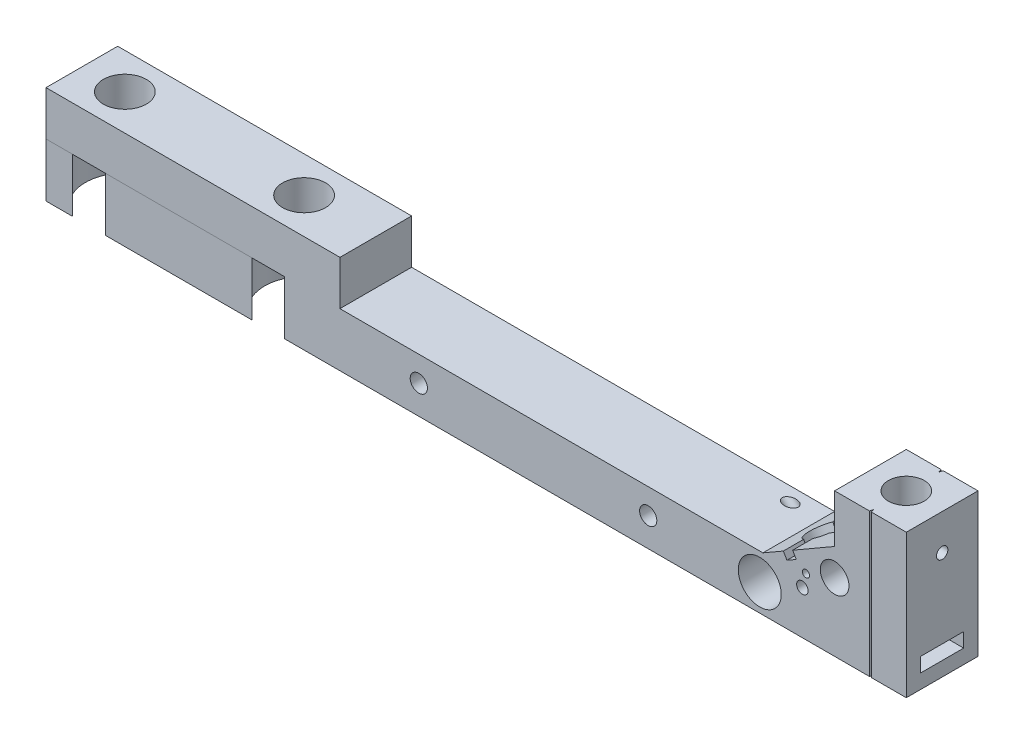
from build123d import *

# Parameters (mm, degrees)
SKETCH1_W                                    = 20
SKETCH1_H                                    = 10
BOSS_EXTRUDE1_DEPTH                          = 20
SKETCH2_R                                    = 2.5
CUT_EXTRUDE1_DEPTH                           = 26.836409614
CUT_EXTRUDE2_DEPTH                           = 27.191969955
CUT_EXTRUDE5_DEPTH                           = 20.59843291
M2X0_4_TAPPED_HOLE1_D                        = 1.6
M2X0_4_TAPPED_HOLE1_DEPTH                    = 6
M2X0_4_TAPPED_HOLE1_TIP                      = 0.480688495
M2X0_4_TAPPED_HOLE2_D                        = 1.6
M2X0_4_TAPPED_HOLE2_DEPTH                    = 6
M2X0_4_TAPPED_HOLE2_TIP                      = 0.480688495
SKETCH14_W                                   = 10
SKETCH14_H                                   = 7.505553499
BOSS_EXTRUDE3_DEPTH                          = 100
CUT_EXTRUDE7_REACH                           = 116.68
SKETCH15_R                                   = 3
SKETCH18_R                                   = 0.5
CUT_EXTRUDE9_DEPTH                           = 3
SKETCH23_R                                   = 5.5
CUT_EXTRUDE10_DEPTH                          = 8
SKETCH24_W                                   = 41
SKETCH24_H                                   = 10
SKETCH24_R                                   = 3
BOSS_EXTRUDE4_DEPTH                          = 6.2
SKETCH27_R                                   = 2
CUT_EXTRUDE11_DEPTH                          = 116.817947978
M2X0_4_TAPPED_HOLE4_OUTLINE_W                = 0.8
M2X0_4_TAPPED_HOLE4_OUTLINE_H                = 1.439804136
SKETCH32_R                                   = 3
CUT_EXTRUDE12_DEPTH                          = 116.817947978
CBORE_FOR_M2_HEX_SOCKET_HEAD_CAP2_AT_2_COUNT = 2
CBORE_FOR_M2_HEX_SOCKET_HEAD_CAP2_AT_2_PITCH = 32
M2X0_4_START                                 = -18.717024707
M2X0_4_TAPPED_HOLE7_OUTLINE_R                = 0.8
M2X0_4_TAPPED_HOLE7_DEPTH                    = 3.215861518
SKETCH48_W                                   = 6
SKETCH48_H                                   = 2
CUT_EXTRUDE14_DEPTH                          = 8


# Read off the part's stored shape, not the designer's step: M2x0.4 Tapped Hole4, M2x0.4 Tapped Hole7
with BuildPart() as part:
    # Sketch1 → Boss-Extrude1 (new body)
    with BuildSketch(Plane(origin=(0, 0, 0), x_dir=(1, 0, 0), z_dir=(0, 1, 0))):
        with Locations((-3.638888889, 4.027777778)):
            Rectangle(SKETCH1_W, SKETCH1_H)
    extrude(amount=BOSS_EXTRUDE1_DEPTH)

    # Sketch2 → Cut-Extrude1 (cut, through all)
    with BuildSketch(Plane(origin=(0, 20, 0), x_dir=(1, 0, 0), z_dir=(0, 1, 0))):
        with Locations(Location((1.361111111, 4.027777778, 0), (0, 0, 270))):
            Circle(SKETCH2_R)
        Polygon((1.495085707, -0.972222222), (1.361111111, -0.472222222), (1.227136515, -0.972222222), align=None)
        Polygon((1.361111111, 8.527777778), (1.227136515, 9.027777778), (1.495085707, 9.027777778), align=None)
    extrude(amount=-CUT_EXTRUDE1_DEPTH, mode=Mode.SUBTRACT)

    # Sketch3 → Cut-Extrude2 (cut, through all)
    with BuildSketch(Plane.XY.offset(0.972222222)):
        Polygon((-13.638888889, 20), (-3.638888889, 20), (-3.638888889, 13.279056191), (-9.489369836, 9.901279442), (-8.989369836, 9.035254038), (-10.288407942, 8.285254038), (-10.788407942, 9.151279442), (-13.638888889, 7.505553499), align=None)
    extrude(amount=-CUT_EXTRUDE2_DEPTH, mode=Mode.SUBTRACT)

    # Sketch5 → Cut-Extrude5 (cut, through all)
    with BuildSketch(Plane(origin=(-6.659722222, 11.534977253, 0), x_dir=(0.8660254037844415, 0.49999999999999534, 0), z_dir=(-0.49999999999999534, 0.8660254037844415, 0))):
        with BuildLine():
            ThreePointArc((-4.993480159, 6.110386473), (-5.64374122, 2.401432181), (-1.934786927, 3.051693242))
            ThreePointArc((-1.934786927, 3.051693242), (-0.717395623, 4.027777778), (-1.934786927, 5.003862313))
            ThreePointArc((-1.934786927, 5.003862313), (-2.391050026, 5.654123375), (-3.041311087, 6.110386473))
            ThreePointArc((-3.041311087, 6.110386473), (-4.017395623, 7.327777778), (-4.993480159, 6.110386473))
        make_face()
    extrude(amount=-CUT_EXTRUDE5_DEPTH, mode=Mode.SUBTRACT)

    # M2x0.4 Tapped Hole1
    with Locations(Plane(origin=(6.361111111, 0, 0), x_dir=(0, 0, -1), z_dir=(1, 0, 0))):
        with Locations((4.027777778, 15)):
            Hole(M2X0_4_TAPPED_HOLE1_D / 2, depth=M2X0_4_TAPPED_HOLE1_DEPTH)
            with Locations((0, 0, -(M2X0_4_TAPPED_HOLE1_DEPTH + M2X0_4_TAPPED_HOLE1_TIP / 2))):  # 118° drill point
                Cone(0, M2X0_4_TAPPED_HOLE1_D / 2, M2X0_4_TAPPED_HOLE1_TIP, mode=Mode.SUBTRACT)

    # M2x0.4 Tapped Hole2
    with Locations(Plane.XY.offset(0.972222222)):
        with Locations((-8.138888889, 6.062177826)):
            Hole(M2X0_4_TAPPED_HOLE2_D / 2, depth=M2X0_4_TAPPED_HOLE2_DEPTH)
            with Locations((0, 0, -(M2X0_4_TAPPED_HOLE2_DEPTH + M2X0_4_TAPPED_HOLE2_TIP / 2))):  # 118° drill point
                Cone(0, M2X0_4_TAPPED_HOLE2_D / 2, M2X0_4_TAPPED_HOLE2_TIP, mode=Mode.SUBTRACT)

    # Sketch14 → Boss-Extrude3 (add)
    with BuildSketch(Plane.ZY.offset(13.638888889)):
        with Locations((-4.027777778, 3.75277675)):
            Rectangle(SKETCH14_W, SKETCH14_H)
    extrude(amount=BOSS_EXTRUDE3_DEPTH)

    # Sketch15 → Cut-Extrude7 (cut, up to next)
    with BuildSketch(Plane(origin=(0, 7.505553499, 0), x_dir=(1, 0, 0), z_dir=(0, 1, 0)), mode=Mode.PRIVATE) as cut_extrude7_sk1:
        with Locations(Location((-107.638888889, 4.027777778, 0), (0, 0, 270))):
            Circle(SKETCH15_R)
    cut_extrude7_tool1 = extrude(cut_extrude7_sk1.sketch, amount=-CUT_EXTRUDE7_REACH, mode=Mode.PRIVATE) & part.part
    # Sketch15 → Cut-Extrude7 (cut, up to next)
    with BuildSketch(Plane(origin=(0, 7.505553499, 0), x_dir=(1, 0, 0), z_dir=(0, 1, 0)), mode=Mode.PRIVATE) as cut_extrude7_sk2:
        with Locations(Location((-82.638888889, 4.027777778, 0), (0, 0, 270))):
            Circle(SKETCH15_R)
    cut_extrude7_tool2 = extrude(cut_extrude7_sk2.sketch, amount=-CUT_EXTRUDE7_REACH, mode=Mode.PRIVATE) & part.part
    add(cut_extrude7_tool1.solids().sort_by_distance((-107.638889, 7.505553, -4.027778))[0], mode=Mode.SUBTRACT)
    add(cut_extrude7_tool2.solids().sort_by_distance((-82.638889, 7.505553, -4.027778))[0], mode=Mode.SUBTRACT)

    # Sketch18 → Cut-Extrude9 (cut)
    with BuildSketch(Plane.XY.offset(0.972222222)):
        with Locations((-7.638888889, 8)):
            Circle(SKETCH18_R)
    extrude(amount=-CUT_EXTRUDE9_DEPTH, mode=Mode.SUBTRACT)

    # Sketch23 → Cut-Extrude10 (cut)
    with BuildSketch(Plane.XZ):
        with Locations((-107.638888889, -4.027777778)):
            Circle(SKETCH23_R)
        with Locations((-82.638888889, -4.027777778)):
            Circle(SKETCH23_R)
    extrude(amount=-CUT_EXTRUDE10_DEPTH, mode=Mode.SUBTRACT)


with BuildPart() as cut_extrude10_piece_1:
    # of the separate pieces the step leaves, piece 1, a body of its own (cut_extrude10_pieces)
    add(part.part.solids().sort_by_distance((1.227136515, 20, -9.027777778))[0])

    # Sketch24 → Boss-Extrude4 (add)
    with BuildSketch(Plane(origin=(0, 7.505553499, 0), x_dir=(1, 0, 0), z_dir=(0, 1, 0))):
        with Locations((-93.138888889, 4.027777778)):
            Rectangle(SKETCH24_W, SKETCH24_H)
        with Locations(Location((-107.638888889, 4.027777778, 0), (0, 0, 90))):
            Circle(SKETCH24_R, mode=Mode.SUBTRACT)
        with Locations(Location((-82.638888889, 4.027777778, 0), (0, 0, 90))):
            Circle(SKETCH24_R, mode=Mode.SUBTRACT)
    extrude(amount=BOSS_EXTRUDE4_DEPTH)

    # Sketch27 → Cut-Extrude11 (cut, through all)
    with BuildSketch(Plane(origin=(0, 0, -9.027777778), x_dir=(-1, 0, 0), z_dir=(0, 0, -1))):
        with Locations((3.638888889, 9.5)):
            Circle(SKETCH27_R)
    extrude(amount=-CUT_EXTRUDE11_DEPTH, mode=Mode.SUBTRACT)

    # M2x0.4 Tapped Hole4 outline → M2x0.4 Tapped Hole4 (revolve, cut)
    with BuildSketch(Plane(origin=(1.384454001, 0.79931489, -4.027777778), x_dir=(0.8660254037844406, 0.4999999999999967, 0), z_dir=(0, 0, -1))):
        with Locations((0.4, -12.599542376)):
            Rectangle(M2X0_4_TAPPED_HOLE4_OUTLINE_W, M2X0_4_TAPPED_HOLE4_OUTLINE_H)
    revolve(axis=Axis((1.384454001, 0.79931489, -4.027777778), (0.4999999999999967, -0.8660254037844406, 0)), mode=Mode.SUBTRACT)

    # Sketch32 → Cut-Extrude12 (cut, through all)
    with BuildSketch(Plane(origin=(0, 0, -9.027777778), x_dir=(-1, 0, 0), z_dir=(0, 0, -1))):
        with Locations((14.080168947, 3.75277675)):
            Circle(SKETCH32_R)
    extrude(amount=-CUT_EXTRUDE12_DEPTH, mode=Mode.SUBTRACT)

    # Sketch41 → CBORE for M2 Hex Socket Head Cap2 (revolve, cut)
    with BuildSketch(Plane(origin=(-61.638888889, 4, -9.027777778), x_dir=(0, 1, 0), z_dir=(1, 0, 0))):
        Polygon((0, 0), (0, 10), (1.2, 10), (1.2, 2), (2.2, 2), (2.2, 0), align=None)
    cbore_for_m2_hex_socket_head_cap2 = revolve(axis=Axis((-61.638888889, 4, -15.377777778), (0, 0, 1)), mode=Mode.SUBTRACT)

    # CBORE for M2 Hex Socket Head Cap2 at 2: CBORE for M2 Hex Socket Head Cap2 ×2
    with Locations(*[(i * CBORE_FOR_M2_HEX_SOCKET_HEAD_CAP2_AT_2_PITCH, 0, 0) for i in range(1, CBORE_FOR_M2_HEX_SOCKET_HEAD_CAP2_AT_2_COUNT)]):
        add(cbore_for_m2_hex_socket_head_cap2, mode=Mode.SUBTRACT)

    # M2x0.4 Tapped Hole7 outline → M2x0.4 Tapped Hole7 (cut)
    with BuildSketch(Plane(origin=(0, 0, 0), x_dir=(0.707106781186549, 0.707106781186546, 0), z_dir=(0.707106781186546, -0.707106781186549, 0)).offset(M2X0_4_START)):
        with Locations((-7.302569055, -7.027777778)):
            Circle(M2X0_4_TAPPED_HOLE7_OUTLINE_R)
    extrude(amount=M2X0_4_TAPPED_HOLE7_DEPTH, mode=Mode.SUBTRACT)

    # Sketch48 → Cut-Extrude14 (cut)
    with BuildSketch(Plane(origin=(6.361111111, 0, 0), x_dir=(0, 0, -1), z_dir=(1, 0, 0))):
        with Locations((4.027777778, 3)):
            Rectangle(SKETCH48_W, SKETCH48_H)
    extrude(amount=-CUT_EXTRUDE14_DEPTH, mode=Mode.SUBTRACT)


with BuildPart() as cut_extrude10_piece_2:
    # of the separate pieces the step leaves, piece 2, a body of its own (cut_extrude10_pieces)
    add(part.part.solids().sort_by_distance((-84.930176736, 7.505553499, -9.027777778))[0])


with BuildPart() as cut_extrude10_piece_3:
    # of the separate pieces the step leaves, piece 3, a body of its own (cut_extrude10_pieces)
    add(part.part.solids().sort_by_distance((-109.930176736, 7.505553499, -9.027777778))[0])


solid = Compound([cut_extrude10_piece_1.part, cut_extrude10_piece_2.part, cut_extrude10_piece_3.part])
